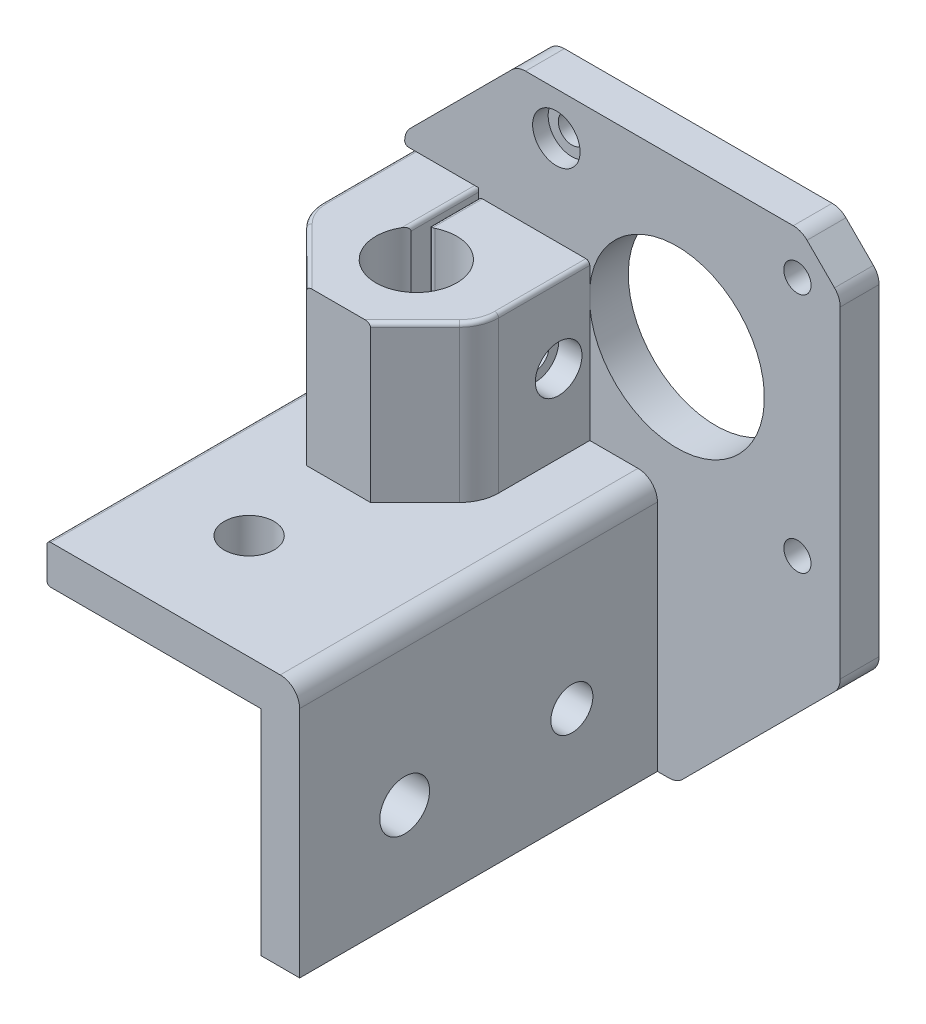
from build123d import *

# Parameters (mm, degrees)
SKETCH1_R           = 11.25
SKETCH1_R_2         = 1.75
BOSS_EXTRUDE1_DEPTH = 5
BOSS_EXTRUDE2_DEPTH = 46
BOSS_EXTRUDE3_DEPTH = 20
CUT_EXTRUDE1_DEPTH  = 1
CUT_EXTRUDE2_DEPTH  = 65.090268372
CUT_EXTRUDE3_REACH  = 71.748
SKETCH6_R           = 2.7
SKETCH6_R_2         = 3.2
CUT_EXTRUDE4_REACH  = 70.949
SKETCH7_R           = 5.2
SKETCH7_R_2         = 3.2
SKETCH8_R           = 3.05
CUT_EXTRUDE5_DEPTH  = 2
FILLET1_R           = 2.5
FILLET2_R           = 5
FILLET3_R           = 0.5


with BuildPart() as part:
    # Sketch1 → Boss-Extrude1 (new body)
    with BuildSketch(Plane.XY):
        Polygon((-13.5, 34.75), (-28, 20.25), (-28, -7.25), (-0.5, -7.25), (-0.5, -34.75), (7, -34.75), (28, -13.75), (28, 29.75), (23, 34.75), align=None)
        with Locations((7, 13.75)):
            Circle(SKETCH1_R, mode=Mode.SUBTRACT)
        with Locations((-8.5, 29.25)):
            Circle(SKETCH1_R_2, mode=Mode.SUBTRACT)
        with Locations(Location((22.5, 29.25, 0), (0, 0, 180))):
            Circle(SKETCH1_R_2, mode=Mode.SUBTRACT)
        with Locations((22.5, -1.75)):
            Circle(SKETCH1_R_2, mode=Mode.SUBTRACT)
    extrude(amount=BOSS_EXTRUDE1_DEPTH)

    # Sketch2 → Boss-Extrude2 (add)
    with BuildSketch(Plane.XY.offset(5)):
        Polygon((-28, -7.25), (-0.5, -7.25), (-0.5, -34.75), (4.5, -34.75), (4.5, -2.25), (-28, -2.25), align=None)
    extrude(amount=BOSS_EXTRUDE2_DEPTH)

    # Sketch3 → Boss-Extrude3 (add)
    with BuildSketch(Plane(origin=(0, -2.25, 0), x_dir=(1, 0, 0), z_dir=(0, 1, 0))):
        with BuildLine():
            Line((-28, -5), (-28, -17.6))
            Line((-28, -17.6), (-19.6, -26))
            Line((-19.6, -26), (-11.4, -26))
            Line((-11.4, -26), (-4.2, -18.8))
            Line((-4.2, -18.8), (-4.2, -5))
            Line((-4.2, -5), (-18.5, -5))
            Line((-18.5, -5), (-18.5, -11.752647884))
            ThreePointArc((-18.5, -11.752647884), (-11.96959369, -19.81788309), (-19.5, -12.677350455))
            Line((-19.5, -12.677350455), (-19.5, -5))
            Line((-19.5, -5), (-28, -5))
        make_face()
    extrude(amount=BOSS_EXTRUDE3_DEPTH)

    # Sketch4 → Cut-Extrude1 (cut)
    with BuildSketch(Plane(origin=(0, -2.25, 0), x_dir=(1, 0, 0), z_dir=(0, 1, 0))):
        with BuildLine():
            Line((-28, -17.6), (-28, 0))
            Line((-28, 0), (-18.5, 0))
            Line((-18.5, 0), (-18.5, -11.752647884))
            ThreePointArc((-18.5, -11.752647884), (-20.681128714, -15.55738815), (-19.176955262, -19.676955262))
            Line((-19.176955262, -19.676955262), (-22.55, -23.05))
            Line((-22.55, -23.05), (-28, -17.6))
        make_face()
    extrude(amount=CUT_EXTRUDE1_DEPTH, mode=Mode.SUBTRACT)

    # Sketch5 → Cut-Extrude2 (cut, through all)
    with BuildSketch(Plane.XY.offset(5)):
        Polygon((-19.5, 17.75), (-28, 17.75), (-28, 18.75), (-18.5, 18.75), (-18.5, -1.25), (-19.5, -1.25), align=None)
    extrude(amount=-CUT_EXTRUDE2_DEPTH, mode=Mode.SUBTRACT)

    # Sketch6 → Cut-Extrude3 (cut, up to next)
    with BuildSketch(Plane(origin=(4.5, 0, 0), x_dir=(0, 0, -1), z_dir=(1, 0, 0)), mode=Mode.PRIVATE) as cut_extrude3_sk1:
        with Locations((-16, -22.25)):
            Circle(SKETCH6_R)
    cut_extrude3_tool1 = extrude(cut_extrude3_sk1.sketch, amount=-CUT_EXTRUDE3_REACH, mode=Mode.PRIVATE) & part.part
    # Sketch6 → Cut-Extrude3 (cut, up to next)
    with BuildSketch(Plane(origin=(4.5, 0, 0), x_dir=(0, 0, -1), z_dir=(1, 0, 0)), mode=Mode.PRIVATE) as cut_extrude3_sk2:
        with Locations((-37.5, -22.25)):
            Circle(SKETCH6_R_2)
    cut_extrude3_tool2 = extrude(cut_extrude3_sk2.sketch, amount=-CUT_EXTRUDE3_REACH, mode=Mode.PRIVATE) & part.part
    add(cut_extrude3_tool1.solids().sort_by_distance((4.5, -22.25, 16))[0], mode=Mode.SUBTRACT)
    add(cut_extrude3_tool2.solids().sort_by_distance((4.5, -22.25, 37.5))[0], mode=Mode.SUBTRACT)

    # Sketch7 → Cut-Extrude4 (cut, up to next)
    with BuildSketch(Plane(origin=(0, -2.25, 0), x_dir=(1, 0, 0), z_dir=(0, 1, 0)), mode=Mode.PRIVATE) as cut_extrude4_sk1:
        with Locations(Location((-15.5, -16, 0), (0, 0, 125.234417985))):
            Circle(SKETCH7_R)
    cut_extrude4_tool1 = extrude(cut_extrude4_sk1.sketch, amount=-CUT_EXTRUDE4_REACH, mode=Mode.PRIVATE) & part.part
    # Sketch7 → Cut-Extrude4 (cut, up to next)
    with BuildSketch(Plane(origin=(0, -2.25, 0), x_dir=(1, 0, 0), z_dir=(0, 1, 0)), mode=Mode.PRIVATE) as cut_extrude4_sk2:
        with Locations(Location((-15.5, -37.5, 0), (0, 0, 270))):
            Circle(SKETCH7_R_2)
    cut_extrude4_tool2 = extrude(cut_extrude4_sk2.sketch, amount=-CUT_EXTRUDE4_REACH, mode=Mode.PRIVATE) & part.part
    add(cut_extrude4_tool1.solids().sort_by_distance((-15.5, -2.25, 16))[0], mode=Mode.SUBTRACT)
    add(cut_extrude4_tool2.solids().sort_by_distance((-15.5, -2.25, 37.5))[0], mode=Mode.SUBTRACT)

    # Sketch8 → Cut-Extrude5 (cut)
    with BuildSketch(Plane.XY.offset(5)):
        with Locations((-8.5, 29.25)):
            Circle(SKETCH8_R)
    extrude(amount=-CUT_EXTRUDE5_DEPTH, mode=Mode.SUBTRACT)

    # Sketch9 → Cut-Revolve1 (revolve, cut)
    with BuildSketch(Plane(origin=(0, 7.75, 0), x_dir=(1, 0, 0), z_dir=(0, 1, 0)), mode=Mode.PRIVATE) as cut_revolve1_sk:
        Polygon((-4.2, -9), (-4.2, -6), (-7.2, -6), (-7.2, -7.25), (-23, -7.25), (-23, -6.65), (-27, -6.65), (-27, -6.5), (-28, -6.5), (-28, -9), align=None)
    revolve(cut_revolve1_sk.sketch.rotate(Axis((-38.14027768, 7.75, 9), (1, 0, 0)), 180), axis=Axis((-38.14027768, 7.75, 9), (1, 0, 0)), mode=Mode.SUBTRACT)

    # Fillet1
    fillet1_edges = [part.edges().sort_by_distance(p)[0] for p in [
        (4.5, -2.25, 28),
        (-28, 20.25, 2.5),
        (7, -34.75, 2.5),
        (28, -13.75, 2.5),
        (28, 29.75, 2.5),
        (23, 34.75, 2.5),
        (-13.5, 34.75, 2.5),
    ]]
    fillet(fillet1_edges, radius=FILLET1_R)

    # Fillet2
    fillet2_edges = [part.edges().sort_by_distance(p)[0] for p in [
        (-28, 8.25, 17.6),
        (-4.2, 7.75, 18.8),
    ]]
    fillet(fillet2_edges, radius=FILLET2_R)

    # Fillet3
    # the kernel refuses this fillet: 0.5 mm, written as the material it takes off along each edge
    with BuildSketch(Plane(origin=(-28, -1.25, 15.528932188), x_dir=(1, 0, 0), z_dir=(0, 0, -1)), Plane(origin=(-28, 17.75, -1.25), x_dir=(1, 0, 0), z_dir=(0, 0, 1))) as fillet3_piece_1:
        with BuildLine():
            CenterArc((FILLET3_R, -FILLET3_R), FILLET3_R, 90, 90)
            Line((0, -FILLET3_R), (0, 0))
            Line((0, 0), (FILLET3_R, 0))
        make_face()
    extrude(amount=16.778932188, mode=Mode.SUBTRACT)
    with BuildSketch(Plane(origin=(-28, 18.75, 6.272209074), x_dir=(0.0007754462768724465, 0.9999996993414906, 0), z_dir=(0, 0, -1))) as fillet3_piece_2:
        with BuildLine():
            CenterArc((0.500387818, 0.499927816), FILLET3_R, 179.955570197, 91.018024984)
            Line((0.000387968, 0.500315539), (-0.049612017, 0.500354311))
            Line((-0.049612017, 0.500354311), (-0.049999985, 3.8772e-05))
            Line((-0.049999985, 3.8772e-05), (-3.8772e-05, -0.049999985))
            ThreePointArc((-3.8772e-05, -0.049999985), (0.464427182, -0.050360153), (0.509733211, -0.049992782))
            Line((0.509733211, -0.049992782), (0.508883629, 0))
        make_face()
    extrude(amount=7.544418147, mode=Mode.SUBTRACT)
    with BuildSketch(Plane(origin=(-28, -7.25, -1.25), x_dir=(0, 1, 0), z_dir=(0, 0, 1))) as fillet3_piece_3:
        with BuildLine():
            CenterArc((FILLET3_R, -FILLET3_R), FILLET3_R, 90, 90)
            Line((0, -FILLET3_R), (0, 0))
            Line((0, 0), (FILLET3_R, 0))
        make_face()
    extrude(amount=53.5, mode=Mode.SUBTRACT)
    with BuildSketch(Plane(origin=(-26.535533906, 17.75, 19.064466094), x_dir=(0, -1, 0), z_dir=(0.707106781186549, 0, 0.707106781186546))) as fillet3_piece_4:
        with BuildLine():
            CenterArc((FILLET3_R, FILLET3_R), FILLET3_R, 180, 90)
            Line((0, FILLET3_R), (0, 0))
            Line((0, 0), (FILLET3_R, 0))
        make_face()
    extrude(amount=11.058326112, mode=Mode.SUBTRACT)
    with BuildSketch(Plane(origin=(-22.55, -1.25, 23.05), x_dir=(0, 1, 0), z_dir=(-0.7071067811865489, 0, -0.7071067811865461))) as fillet3_piece_5:
        with BuildLine():
            CenterArc((FILLET3_R, FILLET3_R), FILLET3_R, 180, 90)
            Line((0, FILLET3_R), (0, 0))
            Line((0, 0), (FILLET3_R, 0))
        make_face()
    extrude(amount=5.636396103, mode=Mode.SUBTRACT)
    with BuildSketch(Plane(origin=(-23, -1.25, 15.528932188), x_dir=(-0.7071067811865456, 0, 0.7071067811865495), z_dir=(0.7071067811865495, 0, 0.7071067811865456))) as fillet3_piece_6:
        with BuildLine():
            CenterArc((5 - FILLET3_R, -FILLET3_R), FILLET3_R, 0, 90)
            Line((5, -FILLET3_R), (5, 0))
            Line((5, 0), (5 - FILLET3_R, 0))
        make_face()
    revolve(axis=Axis((-23, -1.25, 15.528932188), (0, -1, 0)), revolution_arc=45, mode=Mode.SUBTRACT)
    with BuildSketch(Plane(origin=(-4.2, 17.75, 16.728932188), x_dir=(0, -1, 0), z_dir=(0, 0, -1))) as fillet3_piece_7:
        with BuildLine():
            CenterArc((FILLET3_R, FILLET3_R), FILLET3_R, 180, 90)
            Line((0, FILLET3_R), (0, 0))
            Line((0, 0), (FILLET3_R, 0))
        make_face()
    extrude(amount=11.728932188, mode=Mode.SUBTRACT)
    with BuildSketch(Plane(origin=(-9.2, 17.75, 16.728932188), x_dir=(1, 0, 0), z_dir=(0, 0, -1))) as fillet3_piece_8:
        with BuildLine():
            CenterArc((5 - FILLET3_R, FILLET3_R), FILLET3_R, 270, 90)
            Line((5 - FILLET3_R, 0), (5, 0))
            Line((5, 0), (5, FILLET3_R))
        make_face()
    revolve(axis=Axis((-9.2, 17.75, 16.728932188), (0, -1, 0)), revolution_arc=45, mode=Mode.SUBTRACT)
    with BuildSketch(Plane(origin=(-23, 17.75, 15.528932188), x_dir=(-0.7071067811865456, 0, 0.7071067811865495), z_dir=(0.7071067811865495, 0, 0.7071067811865456))) as fillet3_piece_9:
        with BuildLine():
            CenterArc((5 - FILLET3_R, FILLET3_R), FILLET3_R, 270, 90)
            Line((5, FILLET3_R), (5, 0))
            Line((5, 0), (5 - FILLET3_R, 0))
        make_face()
    revolve(axis=Axis((-23, 17.75, 15.528932188), (0, -1, 0)), revolution_arc=45, mode=Mode.SUBTRACT)
    with BuildSketch(Plane(origin=(-28, -2.25, 52.25), x_dir=(1, 0, 0), z_dir=(0, 0, -1))) as fillet3_piece_10:
        with BuildLine():
            CenterArc((FILLET3_R, FILLET3_R), FILLET3_R, 180, 90)
            Line((0, FILLET3_R), (0, 0))
            Line((0, 0), (FILLET3_R, 0))
        make_face()
    extrude(amount=53.5, mode=Mode.SUBTRACT)
    with BuildSketch(Plane(origin=(-18.5, -2.25, 11.752647884), x_dir=(0, 0, -1), z_dir=(0, 1, 0))) as fillet3_piece_11:
        with BuildLine():
            CenterArc((0.875147274, -0.5), FILLET3_R, 90, 116.014366)
            ThreePointArc((0.425805222, -0.719298246), (0.22737913, -0.351079413), (0, 0))
            Line((0, 0), (0.875147274, 0))
        make_face()
    extrude(amount=22.187868184, mode=Mode.SUBTRACT)
    with BuildSketch(Plane(origin=(-12.283883476, 17.75, 26.883883476), x_dir=(0, -1, 0), z_dir=(0.7071067811865485, 0, -0.7071067811865467))) as fillet3_piece_12:
        with BuildLine():
            CenterArc((FILLET3_R, FILLET3_R), FILLET3_R, 180, 90)
            Line((0, FILLET3_R), (0, 0))
            Line((0, 0), (FILLET3_R, 0))
        make_face()
    extrude(amount=9.361269837, mode=Mode.SUBTRACT)
    with BuildSketch(Plane(origin=(-18.5, 17.75, 5), x_dir=(0, -1, 0), z_dir=(0, 0, 1))) as fillet3_piece_13:
        with BuildLine():
            CenterArc((FILLET3_R, FILLET3_R), FILLET3_R, 180, 90)
            Line((0, FILLET3_R), (0, 0))
            Line((0, 0), (FILLET3_R, 0))
        make_face()
    extrude(amount=8.002647884, mode=Mode.SUBTRACT)
    with BuildSketch(Plane(origin=(-19.5, 17.75, 13.927350455), x_dir=(-1, 0, 0), z_dir=(0, 0, -1))) as fillet3_piece_14:
        with BuildLine():
            CenterArc((FILLET3_R, -FILLET3_R), FILLET3_R, 90, 90)
            Line((0, -FILLET3_R), (0, 0))
            Line((0, 0), (FILLET3_R, 0))
        make_face()
    extrude(amount=15.177350455, mode=Mode.SUBTRACT)
    with BuildSketch(Plane(origin=(-19.5, -1.25, 13.927350455), x_dir=(-1, 0, 0), z_dir=(0, 0, -1))) as fillet3_piece_15:
        with BuildLine():
            CenterArc((FILLET3_R, FILLET3_R), FILLET3_R, 180, 90)
            Line((0, FILLET3_R), (0, 0))
            Line((0, 0), (FILLET3_R, 0))
        make_face()
    extrude(amount=15.177350455, mode=Mode.SUBTRACT)


solid = part.part
